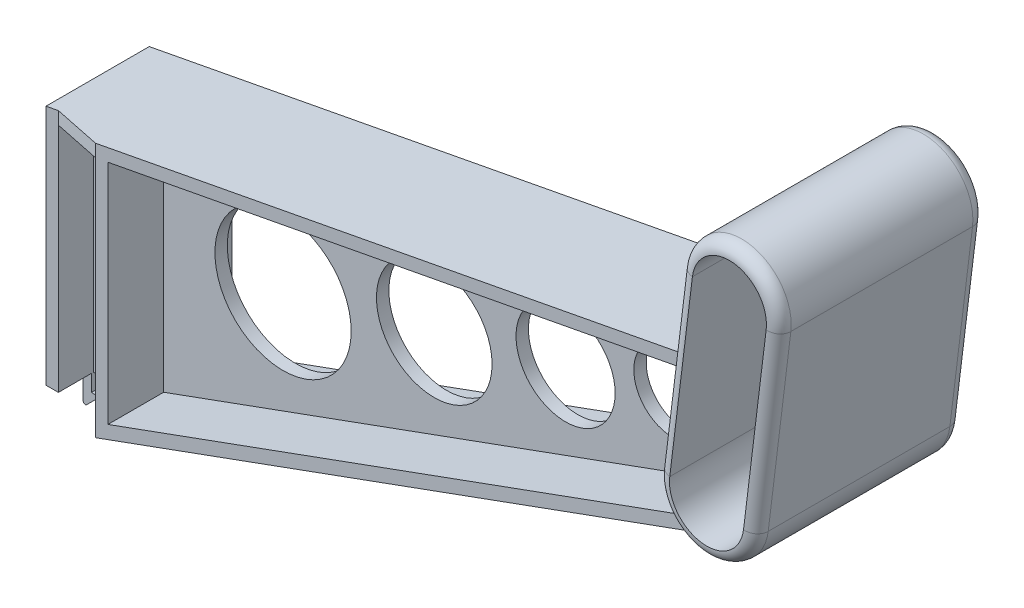
from build123d import *

# Parameters (mm, degrees)
SCHIZZO1_R                    = 16.5
SCHIZZO1_R_2                  = 14
SCHIZZO1_R_3                  = 12
SCHIZZO1_R_4                  = 9.5
ESTRUSIONE_ESTRUSIONE1_DEPTH  = 1.5
ESTRUSIONE_SOTTILE4_DEPTH     = 15
ESTRUSIONE_ESTRUSIONE2_DEPTH  = 25
TAGLIO_ESTRUSIONE1_DEPTH      = 23.5
TAGLIO_ESTRUSIONE2_DEPTH      = 214.121208684
TAGLIO_ESTRUSIONE2_DEPTH_BACK = 214.121208684
ESTRUSIONE_SOTTILE5_DEPTH     = 15
ESTRUSIONE_ESTRUSIONE3_DEPTH  = 1.5
TAGLIO_ESTRUSIONE4_START      = -4.28444402
TAGLIO_ESTRUSIONE4_DEPTH      = 61.768658905
ESTRUSIONE_ESTRUSIONE5_DEPTH  = 2
RACCORDO4_R                   = 3
RACCORDO5_R                   = 3


# Read off the part's stored shape, not the designer's step: Taglio-Estrusione4
with BuildPart() as part:
    # Schizzo1 → Estrusione-Estrusione1 (new, symmetric)
    with BuildSketch(Plane.XY):
        Polygon((0, 55), (0, 0), (155, 56.415386311), (155, 84.415386311), align=None)
        with Locations((28.912269587, 35.505040119)):
            Circle(SCHIZZO1_R, mode=Mode.SUBTRACT)
        with Locations((65.534477731, 45.644757604)):
            Circle(SCHIZZO1_R_2, mode=Mode.SUBTRACT)
        with Locations((97.337974277, 54.450301735)):
            Circle(SCHIZZO1_R_3, mode=Mode.SUBTRACT)
        with Locations((123.359016906, 61.654837842)):
            Circle(SCHIZZO1_R_4, mode=Mode.SUBTRACT)
    extrude(amount=ESTRUSIONE_ESTRUSIONE1_DEPTH, both=True)

    # Schizzo5 → Estrusione-Sottile4 (add, symmetric)
    with BuildSketch(Plane.XY):
        Polygon((158, 88.038261311), (-3, 57.484214885), (-3, -4.28444402), (158, 54.314763697), align=None)
        Polygon((155, 84.415386311), (0, 55), (0, 0), (155, 56.415386311), align=None, mode=Mode.SUBTRACT)
    extrude(amount=ESTRUSIONE_SOTTILE4_DEPTH, both=True)

    # Schizzo6 → Estrusione-Estrusione2 (add, symmetric)
    with BuildSketch(Plane.XY):
        with BuildLine():
            Line((143.08944618, 67.455418384), (148.573566634, 112.119995208))
            ThreePointArc((148.573566634, 112.119995208), (161.946552574, 122.568116907), (172.394674273, 109.195130967))
            Line((172.394674273, 109.195130967), (166.91055382, 64.530554143))
            ThreePointArc((166.91055382, 64.530554143), (153.537567879, 54.082432444), (143.08944618, 67.455418384))
        make_face()
    extrude(amount=ESTRUSIONE_ESTRUSIONE2_DEPTH, both=True)

    # Schizzo7 → Taglio-Estrusione1 (cut)
    with BuildSketch(Plane.XY.offset(25)):
        with BuildLine():
            Line((163.932915365, 64.896162173), (169.417035818, 109.560738997))
            ThreePointArc((169.417035818, 109.560738997), (161.580944544, 119.590478452), (151.551205088, 111.754387178))
            Line((151.551205088, 111.754387178), (146.067084635, 67.089810354))
            ThreePointArc((146.067084635, 67.089810354), (153.903175909, 57.060070899), (163.932915365, 64.896162173))
        make_face()
    taglio_estrusione1 = extrude(amount=-TAGLIO_ESTRUSIONE1_DEPTH, mode=Mode.SUBTRACT)

    # Specchia1: Taglio-Estrusione1 across plane
    add(taglio_estrusione1.mirror(Plane.XY), mode=Mode.SUBTRACT)

    # Schizzo8 → Taglio-Estrusione2 (cut, two sides: drawn at the far end of the back side and taken through both)
    with BuildSketch(Plane.XY.offset(-TAGLIO_ESTRUSIONE2_DEPTH_BACK)):
        with BuildLine():
            Line((149.088066357, 75.282713956), (152.500407973, 103.074006202))
            ThreePointArc((152.500407973, 103.074006202), (160.301316438, 109.16874386), (166.396054096, 101.367835395))
            Line((166.396054096, 101.367835395), (162.98371248, 73.576543149))
            ThreePointArc((162.98371248, 73.576543149), (155.182804015, 67.481805491), (149.088066357, 75.282713956))
        make_face()
    extrude(amount=TAGLIO_ESTRUSIONE2_DEPTH + TAGLIO_ESTRUSIONE2_DEPTH_BACK, mode=Mode.SUBTRACT)

    # Schizzo9 → Estrusione-Sottile5 (add, symmetric)
    with BuildSketch(Plane.XY):
        Polygon((-3, 57.484214885), (-20, 54.258011225), (-20, -4.28444402), (-17, -4.28444402), (-17, 51.77379634), (-2.440653337, 54.536820898), align=None)
    extrude(amount=ESTRUSIONE_SOTTILE5_DEPTH, both=True)

    # Schizzo12 → Estrusione-Estrusione3 (add, symmetric)
    with BuildSketch(Plane.XY):
        Polygon((-17, 51.77379634), (-17, -4.28444402), (-3, -4.28444402), (-3, 54.430669942), align=None)
    extrude(amount=ESTRUSIONE_ESTRUSIONE3_DEPTH, both=True)

    # Taglio-Estrusione4 outline → Taglio-Estrusione4 (cut)
    with BuildSketch(Plane(origin=(0, 0, 0), x_dir=(1, 0, 0), z_dir=(0, 1, 0)).offset(TAGLIO_ESTRUSIONE4_START)):
        Polygon((-3, -15), (-17, -10), (-20, -10), (-20, -15), align=None)
    extrude(amount=TAGLIO_ESTRUSIONE4_DEPTH, mode=Mode.SUBTRACT)

    # Schizzo22 → Estrusione-Estrusione5 (add, symmetric)
    with BuildSketch(Plane.XY):
        with BuildLine():
            Line((-19, -4.28444402), (-19, -11.077337239))
            ThreePointArc((-19, -11.077337239), (-18.691341716, -11.539277005), (-18.146446609, -11.43089063))
            Line((-18.146446609, -11.43089063), (-15, -8.28444402))
            Line((-15, -8.28444402), (-17, -8.28444402))
            Line((-17, -8.28444402), (-17, -4.28444402))
            Line((-17, -4.28444402), (-19, -4.28444402))
        make_face()
    extrude(amount=ESTRUSIONE_ESTRUSIONE5_DEPTH, both=True)

    # Raccordo4
    raccordo4_edges = [part.edges().sort_by_distance(p)[0] for p in [
        (153.537567879, 54.082432444, 25),
        (169.652614046, 86.862842555, 25),
        (161.946552574, 122.568116907, 25),
        (145.831506407, 89.787706796, 25),
    ]]
    fillet(raccordo4_edges, radius=RACCORDO4_R - 0.0001)  # a hair under: the kernel refuses the full size

    # Raccordo5
    raccordo5_edges = [part.edges().sort_by_distance(p)[0] for p in [
        (145.831506407, 89.787706796, -25),
        (153.537567879, 54.082432444, -25),
        (169.652614046, 86.862842555, -25),
        (161.946552574, 122.568116907, -25),
    ]]
    fillet(raccordo5_edges, radius=RACCORDO5_R - 0.0001)  # a hair under: the kernel refuses the full size


solid = part.part
